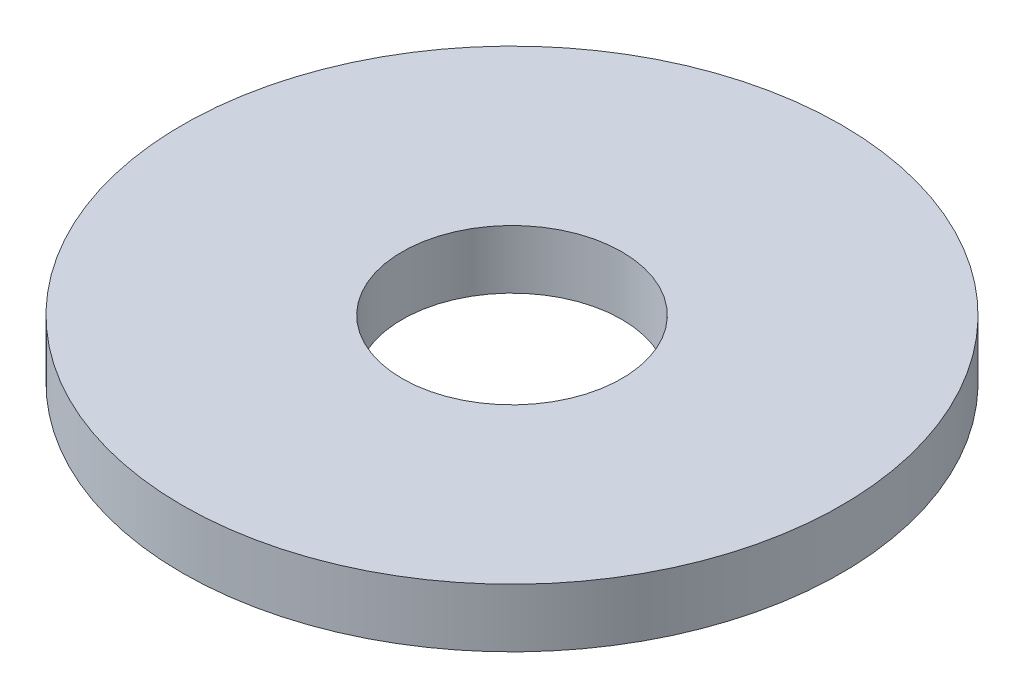
from build123d import *

# Parameters (mm, degrees)
SKETCH1_R           = 9
SKETCH1_R_2         = 3
BOSS_EXTRUDE1_DEPTH = 1.6


with BuildPart() as part:
    # Sketch1 → Boss-Extrude1 (new body)
    with BuildSketch(Plane(origin=(0, 0, 0), x_dir=(1, 0, 0), z_dir=(0, 1, 0))):
        Circle(SKETCH1_R)
        Circle(SKETCH1_R_2, mode=Mode.SUBTRACT)
    extrude(amount=BOSS_EXTRUDE1_DEPTH)


solid = part.part
